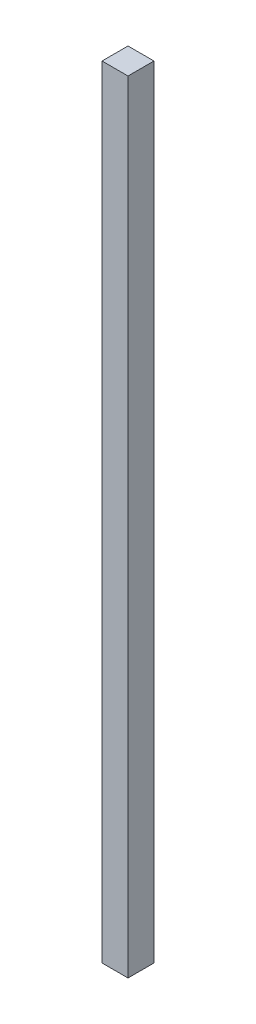
from build123d import *

# Parameters (mm, degrees)
SKETCH1_W           = 3.8
SKETCH1_H           = 3.8
BOSS_EXTRUDE1_DEPTH = 114.3


with BuildPart() as part:
    # Sketch1 → Boss-Extrude1 (new body)
    with BuildSketch(Plane(origin=(0, 0, 0), x_dir=(1, 0, 0), z_dir=(0, 1, 0))):
        Rectangle(SKETCH1_W, SKETCH1_H)
    extrude(amount=BOSS_EXTRUDE1_DEPTH)


solid = part.part
